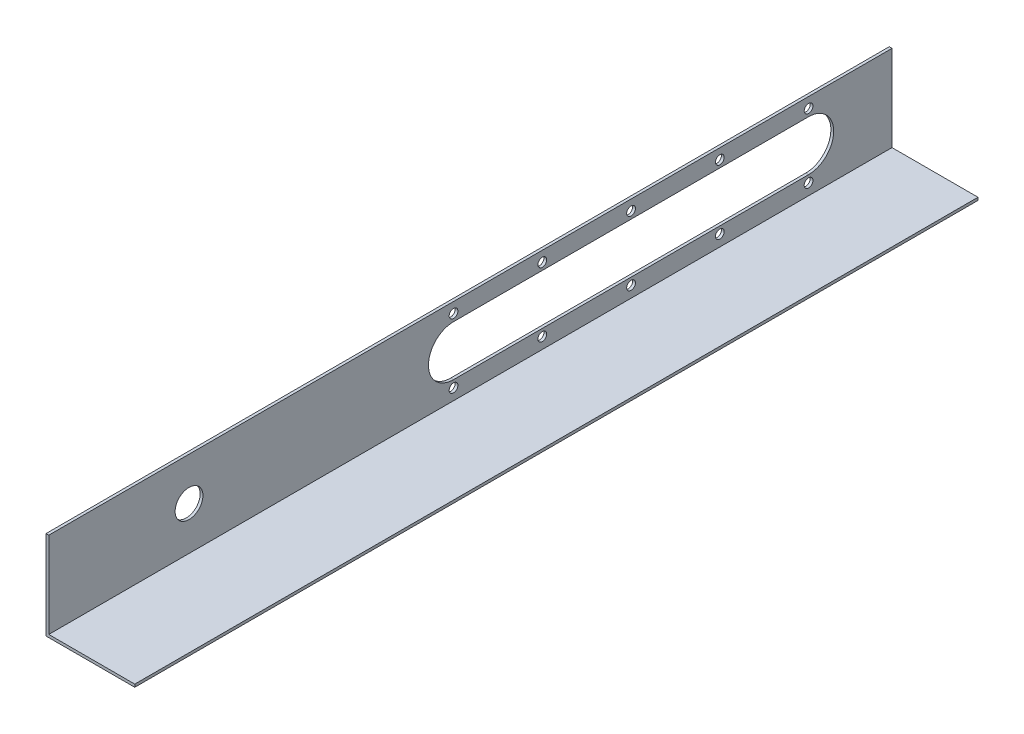
from build123d import *

# Parameters (mm, degrees)
BOSS_EXTRUDE2_DEPTH          = 431.8
CUT_EXTRUDE3_DEPTH           = 127
SKETCH7_R                    = 7.9629
CUT_EXTRUDE4_DEPTH           = 438.372816156
F_10_0_1935_DIAMETER_HOLE1_D = 4.999999906
BOSS_EXTRUDE3_DEPTH          = 50.8


with BuildPart() as part:
    # Sketch3 → Boss-Extrude2 (new body)
    with BuildSketch(Plane.XY):
        Polygon((0, 0), (0, 49.2125), (-1.5875, 49.2125), (-1.5875, -1.5875), (49.2125, -1.5875), (49.2125, 0), align=None)
    extrude(amount=BOSS_EXTRUDE2_DEPTH)

    # Sketch6 → Cut-Extrude3 (cut)
    with BuildSketch(Plane(origin=(0, 0, 0), x_dir=(0, 0, -1), z_dir=(1, 0, 0))):
        with BuildLine():
            Line((-250.952, 39.1795), (-47.752, 39.1795))
            ThreePointArc((-47.752, 39.1795), (-33.401, 24.8285), (-47.752, 10.4775))
            Line((-47.752, 10.4775), (-250.952, 10.4775))
            ThreePointArc((-250.952, 10.4775), (-265.303, 24.8285), (-250.952, 39.1795))
        make_face()
    extrude(amount=-CUT_EXTRUDE3_DEPTH, mode=Mode.SUBTRACT)

    # Sketch7 → Cut-Extrude4 (cut, through all)
    with BuildSketch(Plane(origin=(0, 0, 0), x_dir=(0, 0, -1), z_dir=(1, 0, 0))):
        with Locations((-402.336, 24.773594829)):
            Circle(SKETCH7_R)
    extrude(amount=-CUT_EXTRUDE4_DEPTH, mode=Mode.SUBTRACT)

    # #10 (0.1935) Diameter Hole1 (through all)
    with Locations(Plane(origin=(0, 0, 0), x_dir=(0, 0, -1), z_dir=(1, 0, 0))):
        with Locations((-250.952, 43.2435), (-200.152, 43.2435), (-149.352, 43.2435), (-98.552, 43.2435), (-47.752, 43.2435), (-47.752, 6.4135), (-98.552, 6.4135), (-149.352, 6.4135), (-200.152, 6.4135), (-250.952, 6.4135)):
            Hole(F_10_0_1935_DIAMETER_HOLE1_D / 2)

    # Sketch13 → Boss-Extrude3 (add)
    with BuildSketch(Plane.XY.offset(431.8)):
        Polygon((49.2125, -1.5875), (49.2125, 0), (0, 0), (0, 49.2125), (-1.5875, 49.2125), (-1.5875, -1.5875), align=None)
    extrude(amount=BOSS_EXTRUDE3_DEPTH)


solid = part.part
